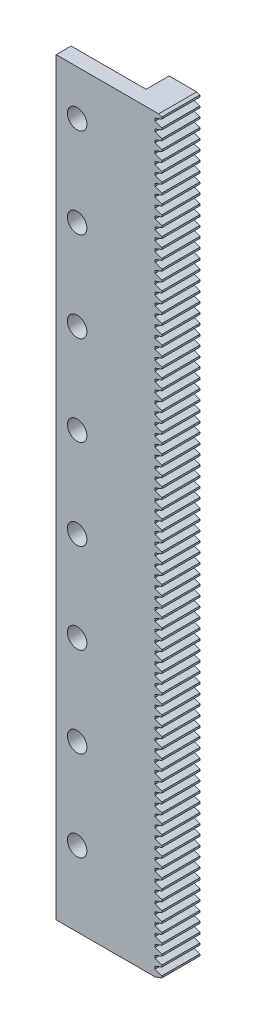
from build123d import *

# Parameters (mm, degrees)
SKETCH2_R           = 1.625
BOSS_EXTRUDE1_DEPTH = 6.35
SKETCH2_3_W         = 12.5
SKETCH2_3_H         = 125
SKETCH2_3_R         = 1.1
CUT_EXTRUDE1_DEPTH  = 3.85


with BuildPart() as part:
    # Sketch2 → Boss-Extrude1 (new body)
    with BuildSketch(Plane.XY):
        Polygon((-3.5, -62.5), (13, -62.5), (14.125, -62.090533486), (14.125, -61.783105558), (13, -61.373639045), (13, -60.929203675), (14.125, -60.519737161), (14.125, -60.212309233), (13, -59.80284272), (13, -59.35840735), (14.125, -58.948940836), (14.125, -58.641512908), (13, -58.232046395), (13, -57.787611025), (14.125, -57.378144511), (14.125, -57.070716583), (13, -56.66125007), (13, -56.2168147), (14.125, -55.807348186), (14.125, -55.499920258), (13, -55.090453745), (13, -54.646018375), (14.125, -54.236551861), (14.125, -53.929123933), (13, -53.51965742), (13, -53.07522205), (14.125, -52.665755536), (14.125, -52.358327608), (13, -51.948861095), (13, -51.504425725), (14.125, -51.094959211), (14.125, -50.787531283), (13, -50.37806477), (13, -49.9336294), (14.125, -49.524162886), (14.125, -49.216734958), (13, -48.807268445), (13, -48.362833075), (14.125, -47.953366561), (14.125, -47.645938633), (13, -47.23647212), (13, -46.79203675), (14.125, -46.382570236), (14.125, -46.075142308), (13, -45.665675795), (13, -45.221240425), (14.125, -44.811773911), (14.125, -44.504345983), (13, -44.09487947), (13, -43.6504441), (14.125, -43.240977586), (14.125, -42.933549658), (13, -42.524083145), (13, -42.079647775), (14.125, -41.670181261), (14.125, -41.362753333), (13, -40.95328682), (13, -40.50885145), (14.125, -40.099384936), (14.125, -39.791957008), (13, -39.382490495), (13, -38.938055125), (14.125, -38.528588611), (14.125, -38.221160683), (13, -37.81169417), (13, -37.3672588), (14.125, -36.957792286), (14.125, -36.650364358), (13, -36.240897845), (13, -35.796462475), (14.125, -35.386995961), (14.125, -35.079568033), (13, -34.67010152), (13, -34.22566615), (14.125, -33.816199636), (14.125, -33.508771708), (13, -33.099305195), (13, -32.654869825), (14.125, -32.245403311), (14.125, -31.937975383), (13, -31.52850887), (13, -31.0840735), (14.125, -30.674606986), (14.125, -30.367179058), (13, -29.957712545), (13, -29.513277175), (14.125, -29.103810661), (14.125, -28.796382733), (13, -28.38691622), (13, -27.94248085), (14.125, -27.533014336), (14.125, -27.225586408), (13, -26.816119895), (13, -26.371684525), (14.125, -25.962218011), (14.125, -25.654790083), (13, -25.24532357), (13, -24.8008882), (14.125, -24.391421686), (14.125, -24.083993758), (13, -23.674527245), (13, -23.230091875), (14.125, -22.820625361), (14.125, -22.513197433), (13, -22.10373092), (13, -21.65929555), (14.125, -21.249829036), (14.125, -20.942401108), (13, -20.532934595), (13, -20.088499225), (14.125, -19.679032711), (14.125, -19.371604783), (13, -18.96213827), (13, -18.5177029), (14.125, -18.108236386), (14.125, -17.800808458), (13, -17.391341945), (13, -16.946906575), (14.125, -16.537440061), (14.125, -16.230012133), (13, -15.82054562), (13, -15.37611025), (14.125, -14.966643736), (14.125, -14.659215808), (13, -14.249749295), (13, -13.805313925), (14.125, -13.395847411), (14.125, -13.088419483), (13, -12.67895297), (13, -12.2345176), (14.125, -11.825051086), (14.125, -11.517623158), (13, -11.108156645), (13, -10.663721275), (14.125, -10.254254761), (14.125, -9.946826833), (13, -9.53736032), (13, -9.09292495), (14.125, -8.683458436), (14.125, -8.376030508), (13, -7.966563995), (13, -7.522128625), (14.125, -7.112662111), (14.125, -6.805234183), (13, -6.39576767), (13, -5.9513323), (14.125, -5.541865786), (14.125, -5.234437858), (13, -4.824971345), (13, -4.380535975), (14.125, -3.971069461), (14.125, -3.663641533), (13, -3.25417502), (13, -2.80973965), (14.125, -2.400273136), (14.125, -2.092845208), (13, -1.683378695), (13, -1.238943325), (14.125, -0.829476811), (14.125, -0.522048883), (13, -0.11258237), (13, 0.331853), (14.125, 0.741319514), (14.125, 1.048747442), (13, 1.458213955), (13, 1.902649325), (14.125, 2.312115839), (14.125, 2.619543767), (13, 3.02901028), (13, 3.47344565), (14.125, 3.882912164), (14.125, 4.190340092), (13, 4.599806605), (13, 5.044241975), (14.125, 5.453708489), (14.125, 5.761136417), (13, 6.17060293), (13, 6.6150383), (14.125, 7.024504814), (14.125, 7.331932742), (13, 7.741399255), (13, 8.185834625), (14.125, 8.595301139), (14.125, 8.902729067), (13, 9.31219558), (13, 9.75663095), (14.125, 10.166097464), (14.125, 10.473525392), (13, 10.882991905), (13, 11.327427275), (14.125, 11.736893789), (14.125, 12.044321717), (13, 12.45378823), (13, 12.8982236), (14.125, 13.307690114), (14.125, 13.615118042), (13, 14.024584555), (13, 14.469019925), (14.125, 14.878486439), (14.125, 15.185914367), (13, 15.59538088), (13, 16.03981625), (14.125, 16.449282764), (14.125, 16.756710692), (13, 17.166177205), (13, 17.610612575), (14.125, 18.020079089), (14.125, 18.327507017), (13, 18.73697353), (13, 19.1814089), (14.125, 19.590875414), (14.125, 19.898303342), (13, 20.307769855), (13, 20.752205225), (14.125, 21.161671739), (14.125, 21.469099667), (13, 21.87856618), (13, 22.32300155), (14.125, 22.732468064), (14.125, 23.039895992), (13, 23.449362505), (13, 23.893797875), (14.125, 24.303264389), (14.125, 24.610692317), (13, 25.02015883), (13, 25.4645942), (14.125, 25.874060714), (14.125, 26.181488642), (13, 26.590955155), (13, 27.035390525), (14.125, 27.444857039), (14.125, 27.752284967), (13, 28.16175148), (13, 28.60618685), (14.125, 29.015653364), (14.125, 29.323081292), (13, 29.732547805), (13, 30.176983175), (14.125, 30.586449689), (14.125, 30.893877617), (13, 31.30334413), (13, 31.7477795), (14.125, 32.157246014), (14.125, 32.464673942), (13, 32.874140455), (13, 33.318575825), (14.125, 33.728042339), (14.125, 34.035470267), (13, 34.44493678), (13, 34.88937215), (14.125, 35.298838664), (14.125, 35.606266592), (13, 36.015733105), (13, 36.460168475), (14.125, 36.869634989), (14.125, 37.177062917), (13, 37.58652943), (13, 38.0309648), (14.125, 38.440431314), (14.125, 38.747859242), (13, 39.157325755), (13, 39.601761125), (14.125, 40.011227639), (14.125, 40.318655567), (13, 40.72812208), (13, 41.17255745), (14.125, 41.582023964), (14.125, 41.889451892), (13, 42.298918405), (13, 42.743353775), (14.125, 43.152820289), (14.125, 43.460248217), (13, 43.86971473), (13, 44.3141501), (14.125, 44.723616614), (14.125, 45.031044542), (13, 45.440511055), (13, 45.884946425), (14.125, 46.294412939), (14.125, 46.601840867), (13, 47.01130738), (13, 47.45574275), (14.125, 47.865209264), (14.125, 48.172637192), (13, 48.582103705), (13, 49.026539075), (14.125, 49.436005589), (14.125, 49.743433517), (13, 50.15290003), (13, 50.5973354), (14.125, 51.006801914), (14.125, 51.314229842), (13, 51.723696355), (13, 52.168131725), (14.125, 52.577598239), (14.125, 52.885026167), (13, 53.29449268), (13, 53.73892805), (14.125, 54.148394564), (14.125, 54.455822492), (13, 54.865289005), (13, 55.309724375), (14.125, 55.719190889), (14.125, 56.026618817), (13, 56.43608533), (13, 56.8805207), (14.125, 57.289987214), (14.125, 57.597415142), (13, 58.006881655), (13, 58.451317025), (14.125, 58.860783539), (14.125, 59.168211467), (13, 59.57767798), (13, 60.02211335), (14.125, 60.431579864), (14.125, 60.739007792), (13, 61.148474305), (13, 61.592909675), (14.125, 62.002376189), (14.125, 62.309804117), (13.602441106, 62.5), (-3.5, 62.5), align=None)
        with Locations((0, -50)):
            Circle(SKETCH2_R, mode=Mode.SUBTRACT)
        with Locations((0, -35)):
            Circle(SKETCH2_R, mode=Mode.SUBTRACT)
        with Locations((0, -20)):
            Circle(SKETCH2_R, mode=Mode.SUBTRACT)
        with Locations((0, -5)):
            Circle(SKETCH2_R, mode=Mode.SUBTRACT)
        with Locations((0, 10)):
            Circle(SKETCH2_R, mode=Mode.SUBTRACT)
        with Locations((0, 25)):
            Circle(SKETCH2_R, mode=Mode.SUBTRACT)
        with Locations((0, 40)):
            Circle(SKETCH2_R, mode=Mode.SUBTRACT)
        with Locations((0, 55)):
            Circle(SKETCH2_R, mode=Mode.SUBTRACT)
    extrude(amount=BOSS_EXTRUDE1_DEPTH)

    # Sketch2<3> → Cut-Extrude1 (cut)
    with BuildSketch(Plane.XY):
        with Locations((2.75, 0)):
            Rectangle(SKETCH2_3_W, SKETCH2_3_H)
        with Locations((0, -50)):
            Circle(SKETCH2_3_R, mode=Mode.SUBTRACT)
        with Locations((0, -35)):
            Circle(SKETCH2_3_R, mode=Mode.SUBTRACT)
        with Locations((0, -20)):
            Circle(SKETCH2_3_R, mode=Mode.SUBTRACT)
        with Locations((0, -5)):
            Circle(SKETCH2_3_R, mode=Mode.SUBTRACT)
        with Locations((0, 10)):
            Circle(SKETCH2_3_R, mode=Mode.SUBTRACT)
        with Locations((0, 25)):
            Circle(SKETCH2_3_R, mode=Mode.SUBTRACT)
        with Locations((0, 40)):
            Circle(SKETCH2_3_R, mode=Mode.SUBTRACT)
        with Locations((0, 55)):
            Circle(SKETCH2_3_R, mode=Mode.SUBTRACT)
    extrude(amount=CUT_EXTRUDE1_DEPTH, mode=Mode.SUBTRACT)


solid = part.part
